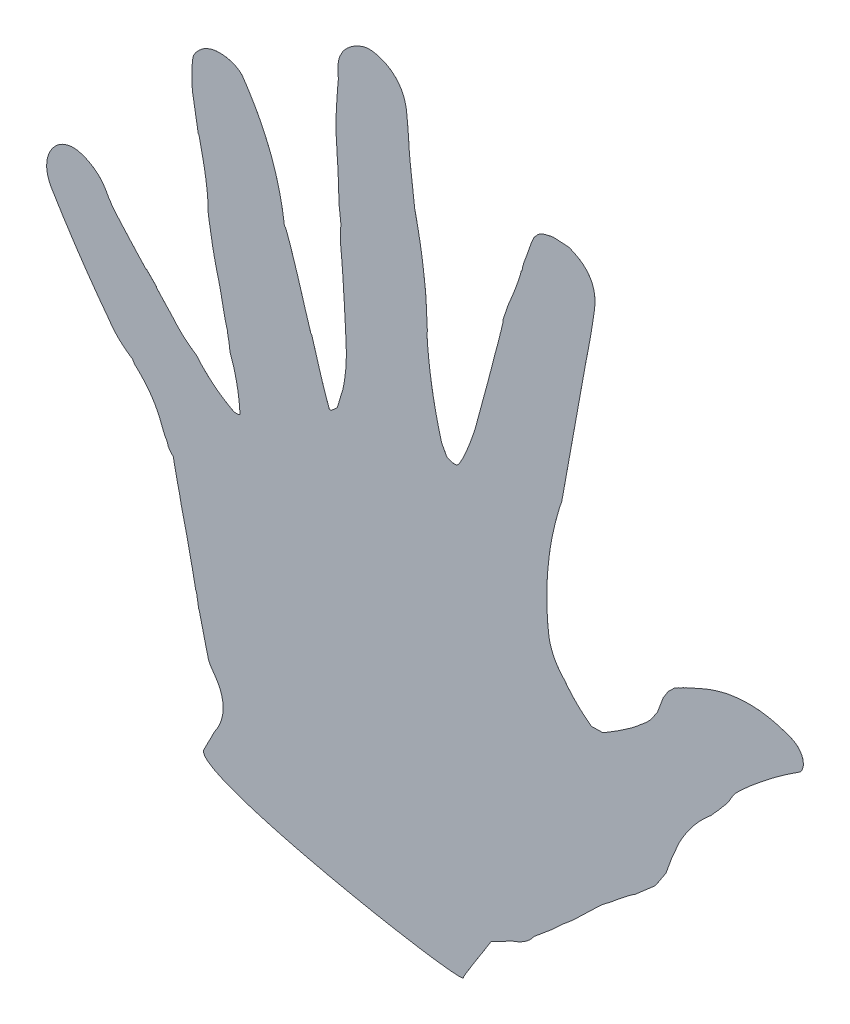
from build123d import *

# Parameters (mm, degrees)
BOSS_EXTRU_1_DEPTH = 0.00254


with BuildPart() as part:
    # Model → Boss.-Extru.1 (new body)
    with BuildSketch(Plane.XY):
        Polygon((179.634513346, -42.804277886), (180.250840929, -38.714777289), (180.296660699, -38.078468153), (180.36452908, -37.480055067), (180.389333767, -36.882503255), (180.411726888, -36.322675239), (180.389333767, -35.744415961), (180.36452908, -35.204569499), (180.250840929, -34.143996853), (180.022775608, -33.121320258), (179.862923177, -32.61988661), (179.725808377, -32.156693522), (179.520825195, -31.674552409), (179.315497504, -31.230996365), (179.087087674, -30.787440321), (178.859366862, -30.382641602), (178.264398872, -29.552545844), (177.94538303, -29.14757487), (177.625678168, -28.78136122), (177.238104926, -28.39568278), (176.872924805, -28.048072645), (176.462269423, -27.70080702), (176.049891493, -27.392643229), (175.57102322, -27.064153375), (175.114892578, -26.774765354), (174.110991753, -26.215970866), (173.01476237, -25.694900174), (172.421172418, -25.443924967), (171.851009115, -25.23187934), (166.873535156, -24.942491319), (165.983666992, -25.116296387), (165.048323568, -25.328169759), (164.157077365, -25.56019694), (163.769159614, -25.675779894), (163.449799262, -25.810310872), (162.879635959, -26.042510308), (162.67258572, -26.157921007), (162.51273329, -26.292796495), (161.988389757, -26.601477051), (160.709225803, -28.068054199), (160.252750651, -29.051112196), (159.773882378, -30.131494141), (159.568899197, -30.672029622), (159.386309136, -31.19258355), (159.203719076, -31.674552409), (159.066948785, -32.137573242), (158.907096354, -32.561147732), (158.770326063, -32.966807726), (158.631833225, -33.333021376), (158.540538194, -33.68063151), (158.403423394, -33.989484321), (158.312472873, -34.278700087), (158.221177843, -34.529675293), (158.152620443, -34.760668945), (158.061669922, -34.953938802), (157.993112522, -35.12739936), (157.947292752, -35.261758084), (157.924555122, -35.378030056), (157.51389974, -36.381069607), (157.194539388, -37.403573947), (156.920998806, -38.444509549), (156.761146376, -39.505598958), (156.531703016, -39.545045302), (156.464523655, -39.775866699), (156.395966254, -40.065082465), (156.303293186, -40.373246257), (156.234735786, -40.721028646), (156.121047635, -41.067949761), (156.006670464, -41.45431722), (155.869900174, -41.859632704), (155.755867513, -42.321792263), (155.573277452, -42.766037326), (155.413769531, -43.267126465), (155.23117947, -43.768904622), (155.04858941, -44.327526855), (154.820524089, -44.887527127), (154.615196398, -45.484906684), (154.362670898, -46.103301324), (154.134605577, -46.758558485), (153.609917535, -48.032038032), (153.107967122, -49.285708279), (152.60601671, -50.462036133), (152.125770399, -51.619415961), (150.619919162, -56.229814996), (150.642656793, -56.827539062), (150.505886502, -57.309507921), (150.369116211, -57.907576497), (150.277821181, -58.235549588), (150.20926378, -58.601418728), (150.025295681, -59.412394206), (149.79723036, -60.280386013), (149.66011556, -60.743234592), (149.546082899, -61.26378852), (149.272542318, -62.344170464), (148.998657227, -63.540135362), (148.816067166, -64.138548448), (148.656559245, -64.79380561), (148.291379123, -66.163575575), (148.086051432, -66.857590061), (147.903805881, -67.61017117), (147.698133681, -68.361891005), (147.515888129, -69.172177463), (147.28610026, -69.962999132), (147.080772569, -70.81152615), (146.624641927, -72.56714681), (146.373838976, -73.454086643), (146.145773655, -74.399765354), (145.642100694, -76.347277832), (144.569986979, -80.244369846), (143.543348524, -84.062913683), (143.040020074, -85.93463406), (142.538069661, -87.78585612), (141.557250977, -91.450920953), (140.711480035, -93.958433702), (139.79921875, -96.466118707), (139.297268338, -97.701013184), (138.793595378, -98.954683431), (138.246169705, -100.189061144), (137.972284614, -100.80590549), (137.835514323, -101.114586046), (137.767301432, -101.269270833), (137.721481662, -101.442903646), (136.556350369, -103.506515842), (136.260072157, -103.892366536), (136.032006836, -104.201219347), (135.917629666, -104.316113281), (135.826334635, -104.4124037), (135.735039605, -104.490435113), (135.689564345, -104.548829481), (135.461499023, -104.625310601), (135.392941623, -104.625310601), (135.347466363, -104.645292155), (135.256171332, -104.683188205), (135.119401042, -104.683188205), (135.050843641, -104.683188205), (135.005023872, -104.702308485), (134.86859809, -104.702308485), (134.798318142, -104.702308485), (134.75422092, -104.72160102), (134.456220161, -104.683188205), (134.182679579, -104.645292155), (133.863319227, -104.567260742), (133.543614366, -104.470798069), (133.315549045, -104.37450765), (133.110221354, -104.297509766), (132.882156033, -104.181754557), (132.812220595, -104.143169488), (132.768123372, -104.123532444), (132.675450304, -104.085291884), (132.334385851, -103.892366536), (130.644911024, -100.767492676), (129.685451931, -97.102600098), (128.841403537, -93.476292589), (128.086927626, -89.849468316), (127.447862413, -86.281210666), (126.90043674, -82.712953016), (126.467043728, -79.183452691), (126.123567708, -75.672039117), (125.895502387, -72.200416395), (126.055010308, -71.969078234), (125.598535156, -62.651989746), (125.347732205, -59.913483344), (125.051109484, -57.387022569), (124.731749132, -54.87950982), (124.38965115, -52.372169325), (124.001733398, -49.883087836), (123.566962348, -47.375575087), (123.087921821, -44.887527127), (122.585971408, -42.398962402), (122.059560818, -39.930551487), (122.014085558, -39.872157118), (122.014085558, -39.814279514), (121.99289822, -39.775866699), (121.99289822, -39.756746419), (121.99289822, -39.717989095), (121.99289822, -39.602061632), (121.945700412, -39.448582628), (121.922790527, -39.40896403), (121.922790527, -39.39018826), (121.922790527, -39.352119954), (121.922790527, -39.274260796), (121.878693305, -39.062387424), (121.878693305, -38.830187988), (121.764660645, -37.96254069), (121.671987576, -37.190839301), (121.626340061, -36.844607205), (121.582242839, -36.477532281), (121.489397515, -35.706175401), (121.445300293, -35.47449273), (121.420840115, -35.358393012), (121.420840115, -35.261758084), (121.3751926, -34.818891059), (121.283897569, -33.892849392), (121.147127279, -32.850880263), (121.078742133, -32.311378309), (121.033094618, -31.751722548), (120.941971842, -31.153998481), (120.896324327, -30.845317925), (120.873414442, -30.690977648), (120.873414442, -30.555585395), (120.736471897, -29.282450358), (120.575241428, -28.106122504), (120.461381022, -26.9875), (120.3487264, -25.926582845), (120.257431369, -24.923371039), (120.166308594, -23.939451769), (120.097751194, -23.033391656), (120.029366048, -22.165227593), (120.006456163, -21.35511339), (119.845225694, -19.17557373), (119.662807888, -17.015154351), (119.457652452, -14.855079481), (119.206504991, -12.713608127), (118.97843967, -11.632881673), (118.704554579, -10.572309028), (118.522136773, -10.03263482), (118.316981337, -9.530684408), (117.86067844, -8.527817112), (117.518408203, -7.92992079), (117.152022298, -7.370437283), (116.764104546, -6.830246311), (116.376359049, -6.348277452), (115.920056152, -5.84632704), (115.462202962, -5.403804525), (114.98299018, -4.978335232), (114.504121908, -4.592484538), (113.95652398, -4.188030328), (113.409098307, -3.840764703), (112.837212457, -3.512619358), (112.244139269, -3.223403592), (111.605418566, -2.934015571), (110.942409939, -2.703194173), (110.257869466, -2.470650228), (109.573501248, -2.297706434), (108.843485514, -2.124418132), (108.134829373, -2.027955458), (107.42755127, -1.988509115), (106.743183051, -2.027955458), (106.057092285, -2.084799533), (105.395633952, -2.239656576), (104.734003364, -2.432409668), (104.093904622, -2.703194173), (103.067093913, -3.165353733), (102.154660373, -3.68625217), (101.309061686, -4.246252441), (100.556308322, -4.843631999), (99.849030219, -5.48011339), (99.231669108, -6.155352105), (98.684071181, -6.869003635), (98.227768283, -7.660169813), (97.817285156, -8.450474718), (97.633144803, -8.855962457), (97.496202257, -9.2995185), (97.245399306, -10.167682563), (97.108629015, -11.112672255), (96.994424099, -12.058178711), (96.994424099, -13.079477268), (96.994424099, -13.581255425), (97.040071615, -14.121790907), (97.19975179, -15.221120877), (96.926038954, -18.190965441), (96.720539008, -21.162015788), (96.538121202, -24.093792046), (96.424088542, -27.006964789), (96.355531141, -28.434095595), (96.378441026, -29.880863444), (96.446826172, -31.327459039), (96.561031087, -32.794036187), (96.652326118, -34.317112901), (96.743448893, -35.918221029), (96.834743924, -37.576345486), (96.971686469, -39.332138401), (96.994424099, -40.180493164), (97.040071615, -41.010761176), (97.085546875, -41.820186361), (97.132744683, -42.611524794), (97.154104275, -43.344468859), (97.19975179, -44.077585178), (97.222489421, -44.771599664), (97.269687229, -45.447010634), (97.269687229, -46.064027235), (97.291046821, -46.681560601), (97.291046821, -47.260508898), (97.336694336, -47.81947564), (97.336694336, -48.340029568), (97.336694336, -48.841463216), (97.336694336, -49.304656304), (97.336694336, -49.517046441), (97.360982259, -49.748212348), (97.360982259, -49.883087836), (97.360982259, -50.095305718), (97.382341851, -50.365745714), (97.427989366, -50.732303874), (97.475187174, -51.118326823), (97.519112142, -51.600467936), (97.587497287, -52.121021864), (97.680342611, -52.737866211), (97.724439833, -53.336451552), (97.747349718, -53.606030273), (97.792997233, -53.87578125), (97.840195041, -54.357922363), (97.840195041, -54.454385037), (97.861210124, -54.570484755), (97.908407932, -54.801995171), (97.908407932, -54.976144748), (97.929767524, -55.168897841), (97.975415039, -55.477233887), (97.975415039, -55.728036838), (97.975415039, -55.824499512), (97.998152669, -55.940426975), (97.998152669, -55.997443305), (97.861210124, -57.618188477), (97.817285156, -59.257709418), (97.861210124, -60.897058105), (98.021062554, -62.555527072), (98.068260362, -63.230765788), (98.159555393, -63.983691406), (98.205202908, -64.755048286), (98.296325684, -65.584971788), (98.341800944, -66.433154297), (98.433095974, -67.339903429), (98.501653375, -68.285409885), (98.59277615, -69.288104926), (98.638423665, -70.310437012), (98.729718696, -71.371698676), (98.798103841, -72.470511882), (98.889398872, -73.64701199), (98.934874132, -74.823856608), (99.026169162, -76.077526855), (99.117464193, -77.351350911), (99.208759223, -78.681674533), (99.254406738, -79.99339464), (99.345529514, -81.285649957), (99.391177029, -82.539492459), (99.482472059, -83.793162706), (99.529669868, -84.988955349), (99.552579753, -85.568075901), (99.596676975, -86.165972222), (99.64232449, -87.304059516), (99.64232449, -87.574499512), (99.64232449, -87.708858236), (99.666612413, -87.863715278), (99.710537381, -88.44214681), (99.735169813, -89.290501573), (99.735169813, -89.714937337), (99.735169813, -89.927327474), (99.757735189, -90.158665636), (99.779094781, -91.856064182), (99.735169813, -92.68547092), (99.710537381, -93.534514703), (99.64232449, -95.193155924), (99.459734429, -96.813212077), (99.254406738, -98.472542318), (98.980521647, -100.131183539), (98.659783257, -101.828409831), (98.478915744, -102.330360243), (96.811834039, -107.924161784), (94.825564236, -109.640508355), (94.574761285, -109.659973145), (94.415081109, -109.640508355), (94.301048448, -109.582630751), (94.232491048, -109.505460612), (94.050073242, -109.062076823), (93.890393066, -108.599400499), (93.70797526, -108.077468533), (93.523834907, -107.557431369), (93.295769586, -106.978655328), (93.113179525, -106.381103516), (92.885114204, -105.744277615), (92.679614258, -105.08781467), (92.543016222, -104.72160102), (92.428811306, -104.37450765), (92.200745985, -103.62227105), (91.926860894, -102.831449382), (91.698795573, -102.041316732), (91.425082737, -101.19192844), (91.149647352, -100.323764377), (90.875934516, -99.4171875), (90.60222168, -98.472542318), (88.502091471, -91.431800673), (88.273853895, -91.335337999), (87.612223307, -89.213848199), (86.996412489, -87.226889377), (86.401616753, -85.316756185), (85.877100966, -83.52341173), (85.352240668, -81.806548394), (84.873200141, -80.224560547), (84.415519206, -78.720087348), (84.004863824, -77.331369358), (83.592658149, -76.077526855), (83.229200575, -74.920147027), (82.864192708, -73.820817057), (82.543109809, -72.798657227), (82.223749457, -71.814565701), (81.927298991, -70.927453613), (81.653586155, -70.09821913), (81.402438694, -69.346499295), (81.151635742, -68.631641981), (80.923570421, -67.996194119), (80.718070475, -67.417245822), (80.535652669, -66.935276964), (80.35168457, -66.471911621), (80.193554687, -66.105181207), (80.055061849, -65.796845161), (79.941201443, -65.584971788), (79.691604275, -65.449235026), (79.347956, -63.03818495), (78.960038249, -60.685356988), (78.480997721, -58.332012261), (77.954759386, -56.036545139), (77.338776313, -53.740905762), (76.67731798, -51.484195964), (75.924392361, -49.227830675), (75.124441189, -47.028309462), (74.21200765, -44.810012478), (73.252204047, -42.650109863), (72.225737847, -40.489690484), (71.152073839, -38.387665473), (69.988492839, -36.284434679), (68.7549764, -34.220477973), (67.454797363, -32.156693522), (66.107420519, -30.150614421), (65.672477214, -29.668128798), (65.216174316, -29.263330078), (64.714223904, -28.896944173), (64.189535862, -28.569143338), (63.619200304, -28.279927572), (63.001666938, -28.028780111), (62.36277398, -27.816734484), (61.701315647, -27.642929416), (60.811791992, -27.450004069), (59.96602105, -27.334765625), (59.121972656, -27.276715766), (58.346309408, -27.276715766), (57.54653049, -27.315128581), (56.816514757, -27.431228299), (56.084776476, -27.585913086), (55.400408257, -27.816734484), (54.693302409, -28.068054199), (54.053031413, -28.39568278), (53.41431071, -28.761724175), (52.821065267, -29.205452474), (52.226441786, -29.688110352), (51.678843859, -30.227784559), (51.131418186, -30.825508626), (50.652377658, -31.500747342), (50.196074761, -32.291741265), (50.05930447, -32.831932237), (49.943721517, -33.468758138), (49.852426487, -34.143996853), (49.785419379, -34.915525987), (49.715656196, -35.725123427), (49.692746311, -36.631700304), (49.670008681, -37.59632704), (49.692746311, -38.637434896), (49.692746311, -39.660283746), (49.739771864, -40.663151042), (49.785419379, -41.589020454), (49.852426487, -42.495252821), (51.747401259, -53.471154785), (51.952556695, -53.586565484), (52.273639594, -55.091210937), (52.592999946, -56.557099067), (52.729770237, -57.251113553), (52.798155382, -57.598723687), (52.888072374, -57.965798611), (53.026220703, -58.640692817), (53.049302843, -58.794688585), (53.094778103, -58.968493652), (53.186073134, -59.316103787), (53.231720649, -59.624439833), (53.254458279, -59.778607856), (53.300105794, -59.951379395), (53.436876085, -60.588894314), (53.666663954, -61.803807237), (53.757958984, -62.382583279), (53.870441352, -62.961187066), (53.963286675, -63.520153809), (54.007383898, -63.790938314), (54.007383898, -63.848815918), (54.030121528, -63.925641547), (54.077319336, -64.079981825), (54.282647027, -65.46887207), (54.465237088, -66.83881429), (54.533622233, -67.494243707), (54.624745009, -68.169137912), (54.761687554, -69.499806044), (54.852982585, -70.773113336), (54.87589247, -71.390474447), (54.921539985, -72.026955838), (54.9671875, -73.242385525), (54.9671875, -73.839765082), (54.989752875, -74.457642958), (56.016563585, -80.494483778), (56.153333876, -81.305459256), (56.29165446, -82.095936415), (56.427218967, -82.848517524), (56.427218967, -82.924998644), (56.451334635, -83.021978082), (56.496982151, -83.214731174), (56.588277181, -83.600237359), (56.725219727, -84.314233398), (56.861990017, -85.008592394), (56.998932563, -85.664366319), (57.067317708, -85.973046875), (57.158440484, -86.300675456), (57.204087999, -86.590063477), (57.272645399, -86.899088542), (57.409587945, -87.477692329), (57.683300781, -88.557729763), (57.774595812, -89.059163411), (57.911538357, -89.54113227), (57.957185872, -89.753005642), (58.025398763, -89.985377333), (58.163891602, -90.428588867), (58.278096517, -90.968607585), (58.437604438, -91.585624186), (58.595906576, -92.299964735), (58.77970242, -93.109906684), (58.96229248, -93.978070747), (59.166069878, -94.942008464), (59.372775608, -96.002925618), (59.623923069, -97.160477702), (59.806513129, -98.183326552), (59.897635905, -98.665467665), (60.011668566, -99.166556803), (60.194086372, -100.09259847), (60.285381402, -100.516689724), (60.33257921, -100.728907606), (60.40113661, -100.960245768), (60.583554416, -101.751584201), (60.766144477, -102.503304036), (60.948562283, -103.198007541), (61.039857313, -103.506515842), (61.085504829, -103.660683865), (61.108242459, -103.737509494), (61.153889974, -103.834144423), (61.199537489, -104.219650608), (61.245185004, -104.586725532), (61.290660265, -104.895061578), (61.334757487, -105.165329319), (61.334757487, -105.358082411), (61.381955295, -105.531715224), (61.381955295, -105.647642687), (61.42760281, -105.744277615), (61.473250326, -105.917565918), (61.518897841, -106.1297838), (61.562995063, -106.381103516), (61.633102756, -106.670147027), (61.678750271, -106.959535048), (61.724225532, -107.325748698), (61.861168077, -108.116742622), (61.952290853, -108.92668457), (62.043413628, -109.678748915), (62.682306586, -111.511711968), (63.275379774, -113.381882053), (63.77888048, -115.292015245), (64.235183377, -117.279318576), (64.600191243, -119.265243869), (64.896813965, -121.31025255), (65.126257324, -123.374209256), (65.286109755, -125.515163845), (64.966749403, -125.823499891), (63.959747993, -125.90101454), (63.071774631, -125.670193142), (62.180528429, -125.16824273), (61.334757487, -124.685584852), (59.669570584, -123.644476997), (58.84825982, -123.084821235), (58.071046278, -122.525682237), (57.29538303, -121.927613661), (56.565367296, -121.348837619), (55.081047906, -120.075874837), (53.688023546, -118.764154731), (53.003655328, -118.06996799), (52.36476237, -117.375608995), (51.108680556, -115.928841146), (50.013656955, -115.214672852), (48.985640462, -114.462780762), (48.004477268, -113.691079373), (47.067755805, -112.899913194), (46.132412381, -112.051558431), (45.288191732, -111.183394368), (44.442765299, -110.295937771), (43.689839681, -109.389877658), (38.11877577, -103.409880914), (38.11877577, -103.140129937), (35.060564507, -100.034720866), (34.763769531, -99.976154243), (32.228523763, -97.237820095), (29.717738173, -94.479159885), (27.206780328, -91.682259115), (24.741642253, -88.866410319), (24.308076986, -88.326391602), (23.918781196, -87.805493164), (23.530863444, -87.265302192), (23.211330838, -86.725283474), (22.983265516, -86.455015734), (22.800847711, -86.184920247), (22.61825765, -85.895359972), (22.481315104, -85.625953505), (22.093741862, -84.873716905), (21.705996365, -84.198650445), (21.270880805, -83.52341173), (20.837487793, -82.905533854), (20.358275011, -82.307982042), (19.856324599, -81.74832628), (19.307520888, -81.209168837), (18.760095215, -80.726683214), (18.143939887, -80.244369846), (17.526578776, -79.819589572), (16.864775933, -79.414963108), (16.2033176, -79.047888184), (15.473301866, -78.681674533), (14.74173584, -78.392286513), (13.966072591, -78.103243001), (13.190409342, -77.8903361), (12.32224528, -77.697583008), (11.500934516, -77.620585124), (10.679623752, -77.640394423), (9.856762695, -77.774925401), (9.126746962, -77.929782444), (8.465288628, -78.141483561), (7.802107747, -78.392286513), (7.208862305, -78.720087348), (6.615789117, -79.067697483), (6.089550781, -79.472840712), (5.566585286, -79.916052246), (5.108732096, -80.417830404), (4.333068848, -81.362475586), (3.715707737, -82.384979926), (3.283692763, -83.272608778), (2.985692003, -84.217770725), (2.711979167, -85.29780816), (2.620684136, -85.838171387), (2.597774251, -86.397138129), (2.575036621, -87.477692329), (2.620684136, -88.017194282), (2.711979167, -88.577022298), (2.917134603, -89.656542969), (3.283692763, -90.736924913), (3.487642415, -91.257995605), (3.73999566, -91.798186578), (4.355806478, -92.878740777), (6.684346517, -96.659044054), (7.825017632, -98.510610623), (9.012886556, -100.343229167), (11.341082086, -103.930607096), (11.614967177, -104.355559625), (11.751737467, -104.567260742), (11.911589898, -104.798771159), (12.506041124, -105.686227756), (13.692359755, -107.422039117), (14.83303087, -109.119437663), (16.020899794, -110.797715929), (18.349439833, -114.076757813), (19.491316732, -115.67752143), (20.677635362, -117.259681532), (21.819856771, -118.822032335), (23.006175401, -120.365607368), (23.349823676, -120.982107205), (24.07983941, -121.888856337), (24.878412543, -122.795433214), (25.676813422, -123.663597276), (26.56788737, -124.492659505), (27.457755534, -125.283997938), (28.417214627, -126.036062283), (29.398377821, -126.749541558), (30.449304199, -127.444072808), (30.700107151, -127.907093641), (30.996902127, -128.370114475), (31.339000109, -128.794205729), (31.772220866, -129.218641493), (32.435574002, -129.836347114), (33.097032335, -130.491948785), (34.374645996, -131.86137424), (35.516867405, -133.269384766), (36.613441298, -134.75456543), (37.571350098, -136.278675673), (38.438308377, -137.878922526), (39.215521918, -139.518443468), (39.557792155, -140.367314996), (39.899890137, -141.254771593), (40.287807888, -142.277620443), (40.379102919, -142.528423394), (40.424750434, -142.644178602), (40.424750434, -142.662782118), (40.447315809, -142.701711697), (40.492963325, -142.778881836), (40.584258355, -143.010047743), (40.699841309, -143.24155816), (40.721200901, -143.319072808), (40.766848416, -143.415535482), (40.857971191, -143.588823785), (41.040561252, -143.89784885), (41.201619466, -144.167599826), (41.270176866, -144.283355035), (41.359921604, -144.418402778), (41.498414442, -144.649913194), (41.543889703, -144.746031359), (41.612274848, -144.862131076), (41.772127279, -145.286222331), (41.863422309, -145.711002604), (41.885987684, -145.807465278), (41.9316352, -145.903927951), (42.0001926, -146.076871745), (42.0001926, -146.115456814), (42.0001926, -146.135093859), (42.02293023, -146.173678928), (42.068577745, -146.270141602), (42.159872776, -146.42413737), (42.479233127, -146.945380317), (42.844240994, -147.40840115), (43.210799154, -147.81319987), (43.644192166, -148.160465495), (43.712749566, -148.565608724), (43.802322049, -149.047577582), (43.895167372, -149.56882053), (44.032109918, -150.166889106), (44.145970323, -150.802853733), (44.305822754, -151.497384983), (44.465330675, -152.249793837), (44.647920736, -153.059735786), (44.830510796, -153.985777452), (44.898895942, -154.371628147), (44.990190972, -154.738186306), (45.058576118, -155.084762912), (45.149871148, -155.413080512), (45.197068956, -155.702124023), (45.288191732, -155.972908529), (45.332288954, -156.22371148), (45.402396647, -156.454877387), (45.402396647, -156.531703016), (45.402396647, -156.570977105), (45.402396647, -156.589580621), (45.425134277, -156.6285102), (45.4692315, -156.801798503), (45.4692315, -156.860020616), (45.492141385, -156.936501736), (45.539339193, -157.071893989), (45.583436415, -157.226578776), (45.583436415, -157.264819336), (45.607552083, -157.283767361), (46.200797526, -160.389520942), (48.073034668, -168.394544813), (48.301099989, -169.493874783), (48.346747504, -169.744677734), (48.41513265, -170.01477322), (48.552075195, -170.554619683), (48.643197971, -171.056914605), (48.688845486, -171.307717556), (48.757402886, -171.577124023), (48.985640462, -172.599628364), (49.168058268, -173.5642551), (49.396123589, -174.509244792), (49.57871365, -175.415993924), (49.670008681, -175.859722222), (49.785419379, -176.322054036), (49.806778971, -176.515668403), (49.852426487, -176.727197266), (49.943721517, -177.15163303), (50.127517361, -177.961919488), (50.264459907, -178.752913411), (50.264459907, -178.829739041), (50.287369792, -178.926201714), (50.333017307, -179.119471571), (50.424312337, -179.505322266), (50.561082628, -180.218801541), (50.698025174, -180.912988281), (50.811885579, -181.568934462), (50.948828125, -182.205243598), (51.131418186, -182.359928385), (51.884343804, -186.911933051), (52.045402018, -187.066273329), (52.045402018, -187.143443468), (52.068311903, -187.239906141), (52.113959418, -187.432831489), (52.203704156, -187.818682183), (52.38784451, -188.590039062), (52.752507867, -190.114149306), (53.4825236, -193.084510634), (53.801883952, -194.531450738), (54.168614366, -195.958064779), (54.510884603, -197.347127279), (54.87589247, -198.735845269), (54.9671875, -199.160281033), (55.103957791, -199.604353841), (55.263637967, -200.009152561), (55.468965658, -200.433588325), (55.674293349, -200.81909451), (55.925268555, -201.223893229), (56.177621799, -201.609743924), (56.474072266, -202.014887153), (57.204087999, -203.056684028), (57.888628472, -204.098136393), (58.437604438, -205.139933268), (58.688407389, -205.661176215), (58.916644965, -206.201022678), (59.281652832, -207.242819553), (59.555365668, -208.303219944), (59.737955729, -209.345016819), (59.829078505, -210.425054253), (59.78343099, -211.467195638), (59.737955729, -212.007042101), (59.669570584, -212.546888563), (59.441333008, -213.588685438), (59.304562717, -214.128531901), (59.144710286, -214.668722873), (58.734054905, -215.710519748), (58.232276747, -216.790212674), (57.934103733, -217.330403646), (57.614743381, -217.870939128), (56.930375163, -218.950976562), (55.697203234, -221.420421007), (55.354760742, -222.056385634), (55.035400391, -222.674091254), (54.738949924, -223.233230252), (54.486424425, -223.773421224), (54.235449219, -224.236097548), (54.007383898, -224.679825846), (53.801883952, -225.046384006), (53.619466146, -225.412597656), (53.459958225, -225.759518772), (53.41431071, -226.145369466), (53.4825236, -226.53156467), (53.688023546, -226.936707899), (53.963286675, -227.341851128), (54.372391764, -227.785579427), (54.8986301, -228.228963216), (55.560260688, -228.691984049), (56.29165446, -229.154660373), (57.158440484, -229.637318251), (58.116693793, -230.1189426), (59.213267687, -230.640185547), (60.40113661, -231.14144694), (61.701315647, -231.681637912), (63.117422146, -232.221484375), (64.668748644, -232.780967882), (66.016125488, -233.244333225), (67.432059733, -233.706665039), (68.891918945, -234.169685872), (70.444795736, -234.65234375), (72.020410156, -235.115364583), (73.685769314, -235.597333442), (75.39832628, -236.0793023), (77.202006022, -236.581252713), (79.028595649, -237.062877062), (80.946308051, -237.564482964), (82.908117676, -238.066088867), (84.941585286, -238.56735026), (87.017427572, -239.068956163), (89.165100098, -239.570217556), (91.379435221, -240.071823459), (93.662327745, -240.612358941), (95.624309625, -241.036794705), (97.587497287, -241.461230469), (98.54730089, -241.653811306), (98.773815918, -241.692740885), (99.026169162, -241.75027398), (99.529669868, -241.865684679), (101.491651747, -242.290464952), (103.409536404, -242.675971137), (105.327076552, -243.081458876), (105.783379449, -243.158629015), (106.01144477, -243.197214084), (106.262592231, -243.254747179), (107.222223579, -243.448017036), (109.117198351, -243.83352322), (110.029804145, -243.987863498), (110.486107042, -244.065378147), (110.715550401, -244.103963216), (110.966525608, -244.161496311), (112.814302572, -244.508761936), (114.640892198, -244.836390516), (116.490219455, -245.183311632), (116.695719401, -245.203293186), (116.923784722, -245.241878255), (117.379915365, -245.319048394), (118.294071452, -245.473044162), (120.097751194, -245.781380208), (121.878693305, -246.071457248), (123.658085124, -246.379448785), (125.188052029, -246.611303711), (125.918240017, -246.707766385), (126.649633789, -246.823177083), (128.020092773, -247.016102431), (129.34300944, -247.209372287), (129.936254883, -247.266905382), (130.553615994, -247.344075521), (130.827501085, -247.363368056), (131.124123806, -247.401953125), (131.694287109, -247.479123264), (132.745041233, -247.594878472), (133.726204427, -247.710633681), (134.182679579, -247.729926215), (134.615728082, -247.768511285), (135.028106011, -247.788148329), (135.415679253, -247.826388889), (135.758121745, -247.826388889), (136.077482096, -247.845681424), (136.374104818, -247.845681424), (136.647645399, -247.845681424), (136.87571072, -247.807096354), (137.082760959, -247.807096354), (137.402121311, -247.768511285), (137.516153971, -247.729926215), (137.607449002, -247.691341146), (137.630186632, -247.652756076), (137.676006402, -247.633463542), (137.721481662, -247.594878472), (137.858596463, -247.151150174), (138.063579644, -246.765643989), (138.246169705, -246.418722873), (138.474235026, -246.052164714), (138.702300347, -245.646676975), (138.976185438, -245.241878255), (139.548071289, -244.316181098), (139.84469401, -243.814575195), (140.186791992, -243.313313802), (140.506152344, -242.753485786), (140.871332465, -242.174709744), (141.237890625, -241.576985677), (141.648546007, -240.959624566), (142.036119249, -240.303678385), (142.469512261, -239.62843967), (142.904627821, -238.93390842), (143.383840603, -238.220429145), (146.784494358, -232.819552951), (147.60683865, -232.395461697), (148.017494032, -232.182899306), (148.451231554, -231.990662977), (150.09523112, -231.160739475), (151.715115017, -230.312212457), (152.492328559, -229.868139648), (153.290557183, -229.444048394), (153.906540256, -229.212537977), (154.204541016, -229.09643826), (154.523901367, -228.999975586), (154.797786458, -228.865272352), (155.09406467, -228.749172635), (155.664572483, -228.518351237), (155.915375434, -228.36366645), (156.189260525, -228.228963216), (156.715326606, -227.95852322), (157.217277018, -227.669479709), (157.719227431, -227.380436198), (157.810522461, -227.283973524), (157.924555122, -227.206458876), (158.152620443, -227.052118598), (158.243915473, -226.955655924), (158.357948134, -226.878830295), (158.587736003, -226.724145508), (158.975653754, -226.376879883), (159.386309136, -226.029958767), (159.728407118, -225.643763563), (160.0705051, -225.258257378), (160.389865451, -224.853114149), (160.709225803, -224.44797092), (162.216455078, -223.194300673), (166.257552083, -219.819140625), (170.002026367, -216.346828885), (173.174270291, -213.684803602), (182.077086046, -205.120640734), (182.991414388, -204.32964681), (185.000249566, -202.786933051), (185.776085069, -202.188864475), (187.534117296, -200.703683811), (189.337624783, -199.276036241), (191.140098741, -197.868025716), (192.989770508, -196.53718533), (193.194753689, -196.49860026), (199.997439236, -190.557877604), (203.422553168, -185.349582248), (205.454470486, -179.775073242), (206.13866645, -178.328133138), (207.121552192, -175.955840386), (207.645895725, -174.798632812), (208.261878798, -173.679665799), (208.877861871, -172.561387804), (209.564124891, -171.48066135), (210.270713976, -170.399934896), (211.025189887, -169.35848253), (212.599254015, -167.295559353), (213.445024957, -166.292347548), (214.334893121, -165.327720812), (215.247498915, -164.363094076), (216.230040148, -163.437396918), (217.212236871, -162.511010742), (218.284350586, -161.623898655), (218.307432726, -161.546728516), (218.421465386, -161.431662326), (218.490022786, -161.335199653), (218.580973307, -161.219099935), (218.695005968, -161.084396701), (218.854858398, -160.949004449), (219.15148112, -160.563498264), (219.333726671, -160.350935872), (219.561791992, -160.13871799), (219.768842231, -159.868967014), (220.019645182, -159.598871528), (220.270792643, -159.309483507), (220.567415365, -159.020095486), (221.137578668, -158.306271701), (221.411463759, -157.959350586), (221.709464518, -157.650325521), (221.958889431, -157.32304145), (222.211414931, -157.03296441), (222.690283203, -156.474169922), (223.078200955, -155.952926975), (223.443381076, -155.470958116), (223.739659288, -155.027574327), (224.037660048, -154.660671658), (224.357364909, -154.024362522), (224.722200521, -153.425949436), (225.087380642, -152.827880859), (225.520773655, -152.269086372), (225.931429036, -151.709602865), (226.412019857, -151.188704427), (227.415920681, -150.204785156), (229.67590332, -148.14117296), (230.816229926, -147.11832411), (232.004443359, -146.135093859), (234.356754557, -144.186892361), (236.797949219, -142.277620443), (239.241899957, -140.406589084), (241.775423177, -138.59309082), (244.355110677, -136.83781467), (246.979928928, -135.140760634), (247.231076389, -134.773857964), (247.43640408, -134.484814453), (247.572829861, -134.234011502), (247.620027669, -134.137548828), (247.687207031, -134.079326714), (247.778502062, -133.751353624), (247.869797092, -133.442673069), (247.93973253, -133.134337023), (247.983829753, -132.825656467), (247.983829753, -132.073592122), (247.89391276, -131.360112847), (247.801239692, -130.993210178), (247.687207031, -130.645600043), (247.550092231, -130.299023437), (247.39058431, -129.990342882), (247.071223958, -129.48839247), (246.729125977, -129.04535319), (246.363945855, -128.620228407), (245.976372613, -128.254014757), (245.542635091, -127.888145616), (245.085126411, -127.598757595), (244.606258138, -127.3283176), (244.103963216, -127.116444227), (242.231898329, -126.401931424), (240.405308702, -125.804551866), (238.533243815, -125.303290473), (236.706654188, -124.917439779), (234.834589301, -124.608931478), (233.899245877, -124.492659505), (232.986640082, -124.434781901), (231.114575195, -124.338491482), (229.287985569, -124.357784017), (227.415920681, -124.454246691), (225.543511285, -124.666120063), (223.671446398, -124.955508084), (222.736102973, -125.148088921), (221.823497179, -125.380460612), (219.951432292, -125.881722005), (218.079022895, -126.498738607), (216.206613498, -127.193269857), (214.334893121, -128.02284885), (213.604877387, -128.331184896), (212.850401476, -128.67879503), (212.051828342, -129.026060655), (211.230517578, -129.431548394), (210.385091146, -129.797073025), (209.974435764, -129.970705838), (209.609255642, -130.163286675), (208.901977539, -130.511241319), (208.261878798, -130.857817925), (207.645895725, -131.147205946), (207.349273003, -131.282598199), (207.098470052, -131.436938477), (206.61925727, -131.706344944), (206.389813911, -131.822789171), (206.20722385, -131.957836914), (204.198388672, -133.867108832), (202.509947374, -136.567719184), (200.638226997, -141.563452148), (200.067374674, -142.411634657), (199.906144206, -142.605249023), (199.792456055, -142.778881836), (199.678423394, -142.933222114), (199.609865994, -143.068269857), (199.541308594, -143.164388021), (199.495833333, -143.24155816), (199.473095703, -143.299780273), (199.473095703, -143.338020833), (198.195654297, -144.99683431), (196.938883464, -146.270141602), (195.067163086, -147.832492405), (194.473917643, -148.353390842), (193.78972168, -148.912874349), (193.012508138, -149.510598416), (192.145377604, -150.185492622), (191.666164822, -150.514154731), (191.164558919, -150.861420356), (190.113804796, -151.613484701), (188.972789171, -152.365549045), (187.739444987, -153.194783529), (186.095445421, -154.217287869), (184.405626085, -155.258740234), (182.991414388, -156.088319227), (179.292759874, -156.184437391), (178.03667806, -155.2394477), (176.872924805, -154.275165473), (175.708138021, -153.271953668), (174.635679796, -152.249793837), (173.562188043, -151.188704427), (172.581024848, -150.089029948), (171.599861654, -148.951114909), (170.708615451, -147.793907335), (170.686222331, -147.755666775), (170.663484701, -147.716737196), (170.5949273, -147.639911567), (170.5263699, -147.562741428), (170.45815701, -147.48522678), (170.41233724, -147.427349175), (170.343779839, -147.350179036), (170.298304579, -147.292645942), (170.207009549, -147.196183268), (170.138452148, -147.11832411), (170.047157118, -147.022205946), (169.978599718, -146.945380317), (169.589648437, -146.501996528), (169.293370226, -146.154730903), (169.156255425, -146.000046115), (169.064960395, -145.884290907), (168.973665365, -145.768535699), (168.928190104, -145.69136556), (168.175092231, -144.649913194), (167.536371528, -143.608116319), (166.964830187, -142.528423394), (166.713682726, -141.968250868), (166.508355035, -141.428748915), (166.074962023, -140.290144857), (165.755257161, -139.132592773), (165.50479872, -137.937489149), (165.343568251, -136.741351997), (165.09242079, -134.272252062), (164.932568359, -131.822789171), (164.818880208, -129.353689236), (164.796142578, -126.92386339), (164.818880208, -124.454246691), (164.932568359, -122.024076335), (165.09242079, -119.593905979), (165.343568251, -117.163391113), (165.618486871, -114.713411458), (165.983666992, -112.282896593), (166.417060004, -109.853070747), (166.941403537, -107.422039117), (167.512255859, -104.991351997), (168.152354601, -102.561353895), (168.859632704, -100.131183539), (169.659583876, -97.719788954), (177.397957357, -55.072779677), (178.197908529, -50.982762316), (178.950661892, -46.893433974), align=None)
    extrude(amount=BOSS_EXTRU_1_DEPTH)


solid = part.part
